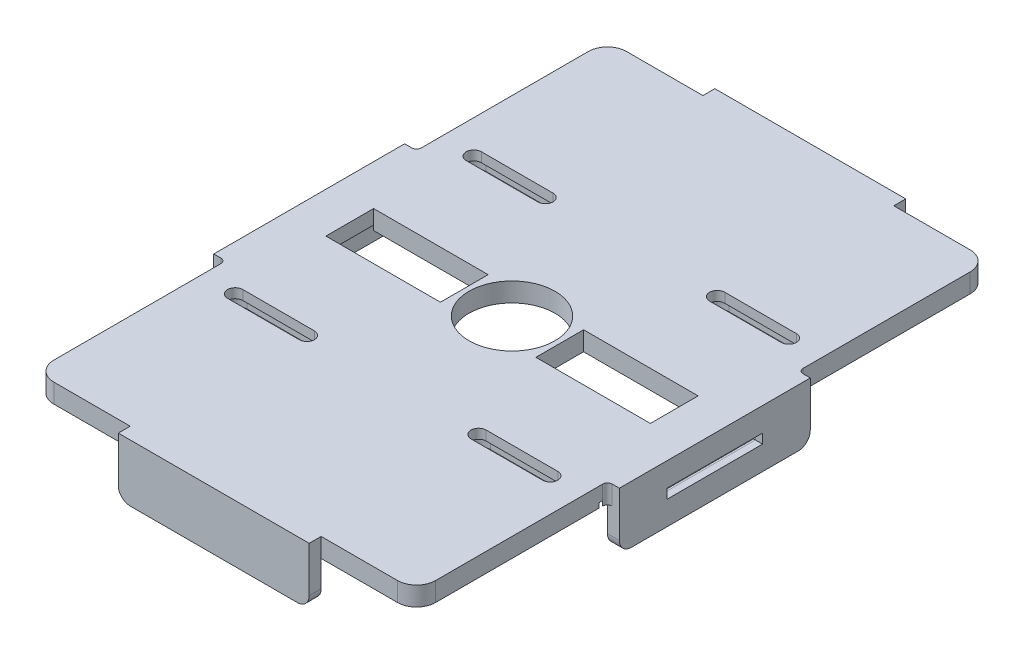
from build123d import *

# Parameters (mm, degrees)
SKETCH2_W                                 = 80
SKETCH2_H                                 = 120
SKETCH2_R                                 = 9
BOSS_EXTRUDE1_DEPTH                       = 4
FILLET1_R                                 = 4
BOSS_EXTRUDE3_START                       = -4
SKETCH3_W                                 = 40
SKETCH3_H                                 = 2.5
BOSS_EXTRUDE3_DEPTH                       = 12
FILLET5_R                                 = 2.5
FILLET5_OF_MIRROR6_R                      = 2.5
BOSS_EXTRUDE4_START                       = -4
SKETCH6_W                                 = 2.5
SKETCH6_H                                 = 39.999999999
BOSS_EXTRUDE4_DEPTH                       = 12
SKETCH13_W                                = 20
SKETCH13_H                                = 2
CUT_EXTRUDE6_DEPTH                        = 2.5
FILLET15_R                                = 1
FILLET15_OF_MIRROR31_R                    = 1
FILLET12_R                                = 1
FILLET9_R                                 = 2.5
SKETCH15_W                                = 24
SKETCH15_H                                = 10
CUT_EXTRUDE7_DEPTH                        = 4
SKETCH16_W                                = 43.464101615
SKETCH16_H                                = 1
CUT_EXTRUDE8_DEPTH                        = 6
CUT_EXTRUDE9_START                        = -2
CUT_EXTRUDE9_DEPTH                        = 2
MIRROR35_START                            = -2
MIRROR35_AT_THE_SECOND_PLANE_COPY_1_DEPTH = 2


with BuildPart() as part:
    # Sketch2 → Boss-Extrude1 (new body)
    with BuildSketch(Plane.XZ.offset(-40.230846757)):
        with Locations((-6.885042722, 0.192082071)):
            Rectangle(SKETCH2_W, SKETCH2_H)
        with Locations(Location((-6.885042722, 0.192082071, 0), (0, 0, 270))):
            Circle(SKETCH2_R, mode=Mode.SUBTRACT)
        with BuildLine():
            Line((-24.885042722, -26.407917929), (-39.885042722, -26.407917929))
            ThreePointArc((-39.885042722, -26.407917929), (-41.485042722, -24.807917929), (-39.885042722, -23.207917929))
            Line((-39.885042722, -23.207917929), (-24.885042722, -23.207917929))
            ThreePointArc((-24.885042722, -23.207917929), (-23.285042722, -24.807917929), (-24.885042722, -26.407917929))
        make_face(mode=Mode.SUBTRACT)
        with BuildLine():
            Line((-24.885042722, 23.592082071), (-39.885042722, 23.592082071))
            ThreePointArc((-39.885042722, 23.592082071), (-41.485042722, 25.192082071), (-39.885042722, 26.792082071))
            Line((-39.885042722, 26.792082071), (-24.885042722, 26.792082071))
            ThreePointArc((-24.885042722, 26.792082071), (-23.285042722, 25.192082071), (-24.885042722, 23.592082071))
        make_face(mode=Mode.SUBTRACT)
        with BuildLine():
            Line((26.114957278, 26.792082071), (11.114957278, 26.792082071))
            ThreePointArc((11.114957278, 26.792082071), (9.514957278, 25.192082071), (11.114957278, 23.592082071))
            Line((11.114957278, 23.592082071), (26.114957278, 23.592082071))
            ThreePointArc((26.114957278, 23.592082071), (27.714957278, 25.192082071), (26.114957278, 26.792082071))
        make_face(mode=Mode.SUBTRACT)
        with BuildLine():
            Line((26.114957278, -23.207917929), (11.114957278, -23.207917929))
            ThreePointArc((11.114957278, -23.207917929), (9.514957278, -24.807917929), (11.114957278, -26.407917929))
            Line((11.114957278, -26.407917929), (26.114957278, -26.407917929))
            ThreePointArc((26.114957278, -26.407917929), (27.714957278, -24.807917929), (26.114957278, -23.207917929))
        make_face(mode=Mode.SUBTRACT)
    extrude(amount=BOSS_EXTRUDE1_DEPTH)

    # Fillet1
    fillet1_edges = [part.edges().sort_by_distance(p)[0] for p in [
        (33.114957278, 38.230846757, -59.807917929),
        (-46.885042722, 38.230846757, -59.807917929),
        (-46.885042722, 38.230846757, 60.192082071),
        (33.114957278, 38.230846757, 60.192082071),
    ]]
    fillet(fillet1_edges, radius=FILLET1_R)

    # Sketch3 → Boss-Extrude3 (add)
    with BuildSketch(Plane.XZ.offset(-36.230846757).offset(BOSS_EXTRUDE3_START)):
        with Locations((-6.885042722, 61.442082071)):
            Rectangle(SKETCH3_W, SKETCH3_H)
    boss_extrude3 = extrude(amount=BOSS_EXTRUDE3_DEPTH)

    # Fillet5
    fillet5_edges = [part.edges().sort_by_distance(p)[0] for p in [
        (13.114957278, 28.230846757, 61.442082071),
        (-26.885042722, 28.230846757, 61.442082071),
    ]]
    fillet(fillet5_edges, radius=FILLET5_R)

    # Mirror6: Boss-Extrude3 across plane
    add(boss_extrude3.mirror(Plane(origin=(0, 0, 0.192082071), x_dir=(1, 0, 0), z_dir=(0, 0, -1))))

    # Fillet5 of Mirror6
    fillet5_of_mirror6_edges = [part.edges().sort_by_distance(p)[0] for p in [
        (13.114957278, 28.230846757, -61.057917929),
        (-26.885042722, 28.230846757, -61.057917929),
    ]]
    fillet(fillet5_of_mirror6_edges, radius=FILLET5_OF_MIRROR6_R)

    # Sketch6 → Boss-Extrude4 (add)
    with BuildSketch(Plane.XZ.offset(-36.230846757).offset(BOSS_EXTRUDE4_START)):
        with Locations((-48.135042722, 0.19208207)):
            Rectangle(SKETCH6_W, SKETCH6_H)
    boss_extrude4 = extrude(amount=BOSS_EXTRUDE4_DEPTH)

    # Sketch13 → Cut-Extrude6 (cut)
    with BuildSketch(Plane.ZY.offset(49.385042722)):
        with Locations((0.192082071, 34.230846757)):
            Rectangle(SKETCH13_W, SKETCH13_H)
    cut_extrude6 = extrude(amount=-CUT_EXTRUDE6_DEPTH, mode=Mode.SUBTRACT)

    # Fillet15
    fillet15_edges = [part.edges().sort_by_distance(p)[0] for p in [
        (-46.885042722, 35.230846757, 0.192082071),
        (-46.885042722, 34.230846757, -9.807917929),
        (-46.885042722, 33.230846757, 0.192082071),
        (-46.885042722, 34.230846757, 10.192082071),
    ]]
    fillet(fillet15_edges, radius=FILLET15_R - 0.0001)  # a hair under: the kernel refuses the full size

    # Mirror31: Boss-Extrude4, Cut-Extrude6 across plane
    add(boss_extrude4.mirror(Plane.ZY.offset(6.885042722)))
    add(cut_extrude6.mirror(Plane.ZY.offset(6.885042722)), mode=Mode.SUBTRACT)

    # Fillet15 of Mirror31
    fillet15_of_mirror31_edges = [part.edges().sort_by_distance(p)[0] for p in [
        (33.114957278, 35.230846757, 0.192082071),
        (33.114957278, 34.230846757, -9.807917929),
        (33.114957278, 33.230846757, 0.192082071),
        (33.114957278, 34.230846757, 10.192082071),
    ]]
    fillet(fillet15_of_mirror31_edges, radius=FILLET15_OF_MIRROR31_R - 0.0001)  # a hair under: the kernel refuses the full size

    # Fillet12
    fillet12_edges = [part.edges().sort_by_distance(p)[0] for p in [
        (-46.885042722, 38.230846757, 20.19208207),
        (-46.885042722, 38.230846757, -19.807917929),
        (33.114957278, 38.230846757, -19.807917929),
        (33.114957278, 38.230846757, 20.19208207),
    ]]
    fillet(fillet12_edges, radius=FILLET12_R)

    # Fillet9
    fillet9_edges = [part.edges().sort_by_distance(p)[0] for p in [
        (-48.135042722, 28.230846757, -19.807917929),
        (-48.135042722, 28.230846757, 20.19208207),
        (34.364957278, 28.230846757, -19.807917929),
        (34.364957278, 28.230846757, 20.19208207),
    ]]
    fillet(fillet9_edges, radius=FILLET9_R)

    # Sketch15 → Cut-Extrude7 (cut)
    with BuildSketch(Plane(origin=(0, 40.230846757, 0), x_dir=(1, 0, 0), z_dir=(0, 1, 0))):
        with Locations((15.114957278, -0.192082071)):
            Rectangle(SKETCH15_W, SKETCH15_H)
    cut_extrude7 = extrude(amount=-CUT_EXTRUDE7_DEPTH, mode=Mode.SUBTRACT)

    # Mirror32: Cut-Extrude7 across plane
    add(cut_extrude7.mirror(Plane.ZY.offset(6.885042722)), mode=Mode.SUBTRACT)

    # Sketch16 → Cut-Extrude8 (cut)
    with BuildSketch(Plane.ZY.offset(46.885042722)):
        with Locations((0.19208207, 36.730846757)):
            Rectangle(SKETCH16_W, SKETCH16_H)
    cut_extrude8 = extrude(amount=-CUT_EXTRUDE8_DEPTH, mode=Mode.SUBTRACT)

    # Mirror34: Cut-Extrude8 across plane
    add(cut_extrude8.mirror(Plane.ZY.offset(6.885042722)), mode=Mode.SUBTRACT)

    # Sketch17 → Cut-Extrude9 (cut)
    with BuildSketch(Plane.XZ.offset(-36.230846757).offset(CUT_EXTRUDE9_START)):
        with BuildLine():
            Line((-39.885042722, 22.692082071), (-24.885042722, 22.692082071))
            ThreePointArc((-24.885042722, 22.692082071), (-22.385042722, 25.192082071), (-24.885042722, 27.692082071))
            Line((-24.885042722, 27.692082071), (-39.885042722, 27.692082071))
            ThreePointArc((-39.885042722, 27.692082071), (-42.385042722, 25.192082071), (-39.885042722, 22.692082071))
        make_face()
        with BuildLine():
            Line((-39.885042722, 23.592082071), (-24.885042722, 23.592082071))
            ThreePointArc((-24.885042722, 23.592082071), (-23.285042722, 25.192082071), (-24.885042722, 26.792082071))
            Line((-24.885042722, 26.792082071), (-39.885042722, 26.792082071))
            ThreePointArc((-39.885042722, 26.792082071), (-41.485042722, 25.192082071), (-39.885042722, 23.592082071))
        make_face(mode=Mode.SUBTRACT)
    cut_extrude9 = extrude(amount=CUT_EXTRUDE9_DEPTH, mode=Mode.SUBTRACT)

    # Mirror35: Cut-Extrude9 across plane
    add(cut_extrude9.mirror(Plane(origin=(0, 0, 0.192082071), x_dir=(1, 0, 0), z_dir=(0, 0, -1))), mode=Mode.SUBTRACT)

    # Mirror35 at the second plane: Cut-Extrude9 across plane
    add(cut_extrude9.mirror(Plane.ZY.offset(6.885042722)), mode=Mode.SUBTRACT)

    # Mirror35 at the second plane copy 1 sket → Mirror35 at the second plane copy 1 (cut)
    with BuildSketch(Plane(origin=(-13.770085443, 36.230846757, 0.384164141), x_dir=(-1, 0, 0), z_dir=(0, -1, 0)).offset(MIRROR35_START)):
        with BuildLine():
            Line((-39.885042722, 22.692082071), (-24.885042722, 22.692082071))
            ThreePointArc((-24.885042722, 22.692082071), (-22.385042722, 25.192082071), (-24.885042722, 27.692082071))
            Line((-24.885042722, 27.692082071), (-39.885042722, 27.692082071))
            ThreePointArc((-39.885042722, 27.692082071), (-42.385042722, 25.192082071), (-39.885042722, 22.692082071))
        make_face()
        with BuildLine():
            Line((-39.885042722, 23.592082071), (-24.885042722, 23.592082071))
            ThreePointArc((-24.885042722, 23.592082071), (-23.285042722, 25.192082071), (-24.885042722, 26.792082071))
            Line((-24.885042722, 26.792082071), (-39.885042722, 26.792082071))
            ThreePointArc((-39.885042722, 26.792082071), (-41.485042722, 25.192082071), (-39.885042722, 23.592082071))
        make_face(mode=Mode.SUBTRACT)
    extrude(amount=MIRROR35_AT_THE_SECOND_PLANE_COPY_1_DEPTH, mode=Mode.SUBTRACT)


solid = part.part
